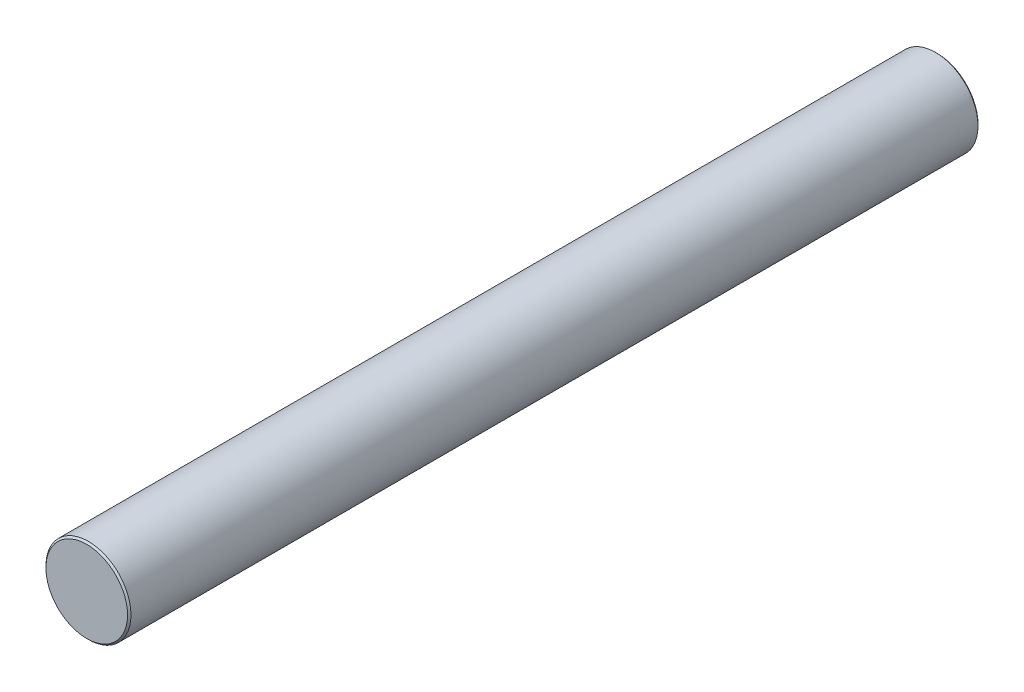
from build123d import *

# Parameters (mm, degrees)
SKETCH1_R           = 6.35
BOSS_EXTRUDE1_DEPTH = 127
CHAMFER1_SIZE       = 0.254


with BuildPart() as part:
    # Sketch1 → Boss-Extrude1 (new body)
    with BuildSketch(Plane.XY):
        Circle(SKETCH1_R)
    extrude(amount=BOSS_EXTRUDE1_DEPTH)

    # Chamfer1
    chamfer1_edges = [part.edges().sort_by_distance(p)[0] for p in [
        (-6.35, 0, 0),
        (-6.35, 0, 127),
    ]]
    chamfer(chamfer1_edges, length=CHAMFER1_SIZE)


solid = part.part
